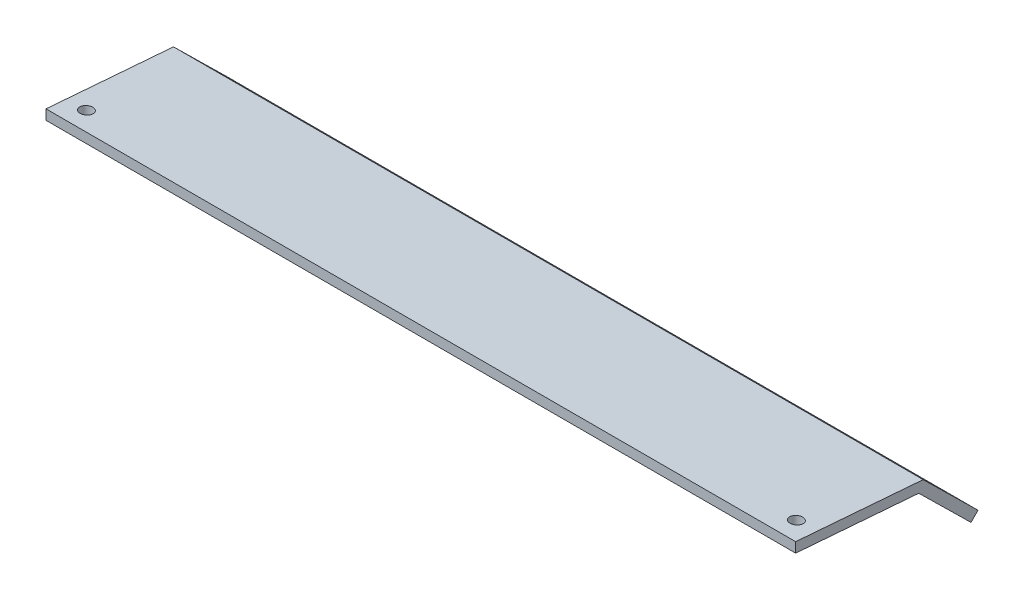
from build123d import *

# Parameters (mm, degrees)
BOSS_EXTRUDE1_DEPTH = 119.85625
SKETCH2_R           = 2.032
CUT_EXTRUDE1_DEPTH  = 136.095780221
SKETCH3_R           = 2.032
CUT_EXTRUDE2_DEPTH  = 12.7


with BuildPart() as part:
    # Sketch1 → Boss-Extrude1 (new, symmetric)
    with BuildSketch(Plane(origin=(0, 0, 0), x_dir=(0, 0, -1), z_dir=(1, 0, 0))):
        Polygon((0, 0), (0, 3.184811635), (40.762900177, -0.022300578), (58.304880654, -17.260912049), (56.079483543, -19.525472204), (39.361772519, -3.096875365), align=None)
    extrude(amount=BOSS_EXTRUDE1_DEPTH, both=True)

    # Sketch2 → Cut-Extrude1 (cut, through all)
    with BuildSketch(Plane(origin=(0, 3.165218593, -0.249030642), x_dir=(1, 0, 0), z_dir=(0, 0.9969192417821154, -0.0784348478966589))):
        with Locations((113.50625, 6.354926815)):
            Circle(SKETCH2_R)
        with Locations((-113.50625, 6.354926815)):
            Circle(SKETCH2_R)
    extrude(amount=-CUT_EXTRUDE1_DEPTH, mode=Mode.SUBTRACT)

    # Sketch3 → Cut-Extrude2 (cut)
    with BuildSketch(Plane(origin=(0, 20.36700431, -20.014779664), x_dir=(1, 0, 0), z_dir=(0, 0.7132472930974809, -0.7009124759120187))):
        with Locations((-113.50625, 48.604186901)):
            Circle(SKETCH3_R)
        with Locations((113.50625, 48.604186901)):
            Circle(SKETCH3_R)
    extrude(amount=-CUT_EXTRUDE2_DEPTH, mode=Mode.SUBTRACT)


solid = part.part
